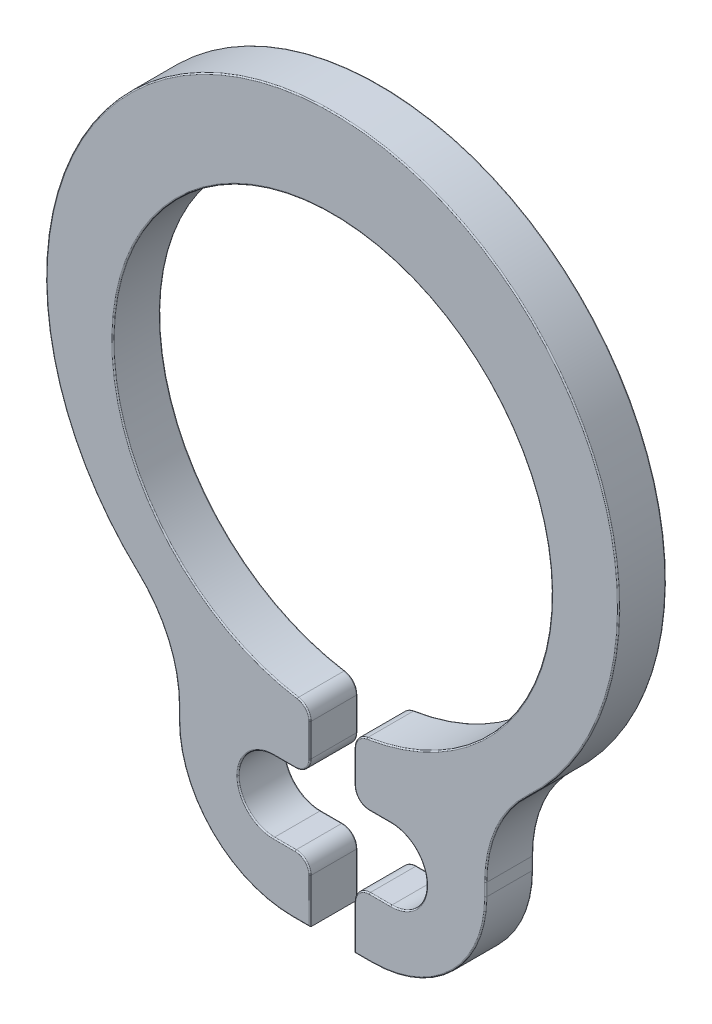
from build123d import *

# Parameters (mm, degrees)
SKETCH3_R                    = 3.7
BOSS_EXTRUDE1_DEPTH          = 0.4
CUT_EXTRUDE_THIN1_DEPTH      = 8.751864292
CUT_EXTRUDE_THIN1_DEPTH_BACK = 8.751864292
SKETCH4_W                    = 0.75
SKETCH4_H                    = 6.9
FILLET2_R                    = 0.25
FILLET1_R                    = 0.02


with BuildPart() as part:
    # Sketch3 → Boss-Extrude1 (new, symmetric)
    with BuildSketch(Plane.XY):
        with BuildLine():
            Line((2.59, -3.918563747), (2.59, -4.13))
            ThreePointArc((2.59, -4.13), (2.02764502, -5.48764502), (0.67, -6.05))
            Line((0.67, -6.05), (-0.67, -6.05))
            ThreePointArc((-0.67, -6.05), (-2.02764502, -5.48764502), (-2.59, -4.13))
            Line((-2.59, -4.13), (-2.59, -3.918563747))
            ThreePointArc((-2.59, -3.918563747), (-2.771946919, -3.045857323), (-3.287471157, -2.318563747))
            ThreePointArc((-3.287471157, -2.318563747), (0, 6.05), (3.287471157, -2.318563747))
            ThreePointArc((3.287471157, -2.318563747), (2.771946919, -3.045857323), (2.59, -3.918563747))
        make_face()
        with Locations((0, 0.85)):
            Circle(SKETCH3_R, mode=Mode.SUBTRACT)
        with BuildLine():
            Line((-0.99, -5.05), (0.99, -5.05))
            ThreePointArc((0.99, -5.05), (1.59, -4.45), (0.99, -3.85))
            Line((0.99, -3.85), (-0.99, -3.85))
            ThreePointArc((-0.99, -3.85), (-1.59, -4.45), (-0.99, -5.05))
        make_face(mode=Mode.SUBTRACT)
    extrude(amount=BOSS_EXTRUDE1_DEPTH, both=True)

    # Sketch4 → Cut-Extrude-Thin1 (cut, two sides: drawn at the far end of the back side and taken through both)
    with BuildSketch(Plane.XY.offset(-CUT_EXTRUDE_THIN1_DEPTH_BACK)):
        with Locations((0, -2.6)):
            Rectangle(SKETCH4_W, SKETCH4_H)
    extrude(amount=CUT_EXTRUDE_THIN1_DEPTH + CUT_EXTRUDE_THIN1_DEPTH_BACK, mode=Mode.SUBTRACT)

    # Fillet2
    fillet2_edges = [part.edges().sort_by_distance(p)[0] for p in [
        (0.375, -5.05, 0),
        (-0.375, -5.05, 0),
        (0.375, -3.85, 0),
        (0.375, -2.830947568, 0),
        (-0.375, -3.85, 0),
        (-0.375, -2.830947568, 0),
    ]]
    fillet(fillet2_edges, radius=FILLET2_R)

    # Fillet1
    fillet1_edges = [part.edges().sort_by_distance(p)[0] for p in [
        (-0.8075, -5.05, -0.4),
        (-1.59, -4.45, -0.4),
        (-0.8075, -3.85, -0.4),
        (0, 4.55, -0.4),
        (0.8075, -3.85, -0.4),
        (1.59, -4.45, -0.4),
        (0.8075, -5.05, -0.4),
        (0.375, -5.675, -0.4),
        (0.5225, -6.05, -0.4),
        (2.02764502, -5.48764502, -0.4),
        (2.59, -4.024281874, -0.4),
        (2.771946919, -3.045857323, -0.4),
        (0, 6.05, -0.4),
        (-2.771946919, -3.045857323, -0.4),
        (-2.59, -4.024281874, -0.4),
        (-2.02764502, -5.48764502, -0.4),
        (-0.5225, -6.05, -0.4),
        (-0.375, -5.675, -0.4),
        (-2.02764502, -5.48764502, 0.4),
        (-2.59, -4.024281874, 0.4),
        (-2.771946919, -3.045857323, 0.4),
        (0, 6.05, 0.4),
        (2.771946919, -3.045857323, 0.4),
        (2.59, -4.024281874, 0.4),
        (2.02764502, -5.48764502, 0.4),
        (0.5225, -6.05, 0.4),
        (0.375, -5.675, 0.4),
        (0.8075, -5.05, 0.4),
        (1.59, -4.45, 0.4),
        (0.8075, -3.85, 0.4),
        (0, 4.55, 0.4),
        (-0.8075, -3.85, 0.4),
        (-1.59, -4.45, 0.4),
        (-0.8075, -5.05, 0.4),
        (-0.375, -5.675, 0.4),
        (-0.5225, -6.05, 0.4),
        (-0.448223305, -5.123223305, -0.4),
        (-0.448223305, -3.776776695, -0.4),
        (-0.375, -3.325120189, -0.4),
        (-0.434751162, -2.888051044, -0.4),
        (0.434751162, -2.888051044, -0.4),
        (0.375, -3.325120189, -0.4),
        (0.448223305, -3.776776695, -0.4),
        (0.448223305, -5.123223305, -0.4),
        (0.448223305, -3.776776695, 0.4),
        (0.375, -3.325120189, 0.4),
        (0.434751162, -2.888051044, 0.4),
        (-0.434751162, -2.888051044, 0.4),
        (-0.375, -3.325120189, 0.4),
        (-0.448223305, -3.776776695, 0.4),
        (-0.448223305, -5.123223305, 0.4),
        (0.448223305, -5.123223305, 0.4),
    ]]
    fillet(fillet1_edges, radius=FILLET1_R)


solid = part.part
